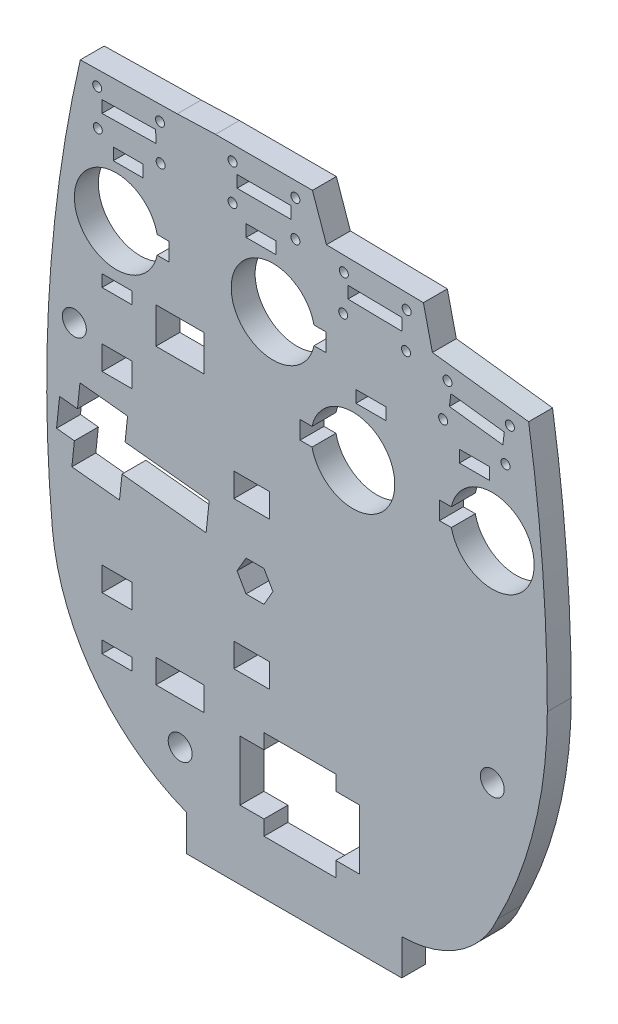
from build123d import *

# Parameters (mm, degrees)
SKETCH1_R           = 2
SKETCH1_R_2         = 0.75
SKETCH1_R_3         = 0.749999998
SKETCH1_R_4         = 0.750000004
SKETCH1_W           = 9
SKETCH1_H           = 2
SKETCH1_W_2         = 5
SKETCH1_W_3         = 8
SKETCH1_H_2         = 6.000000353
SKETCH1_H_3         = 4
SKETCH1_W_4         = 6.000000352
BOSS_EXTRUDE1_DEPTH = 4


with BuildPart() as part:
    # Sketch1 → Boss-Extrude1 (new body)
    with BuildSketch(Plane.XY):
        with BuildLine():
            Line((-12.978641063, -17.999999648), (-12.978641063, -24))
            Line((-12.978641063, -24), (23.021361236, -24))
            Line((23.021361236, -24), (23.021361236, -17.999999648))
            ThreePointArc((23.021361236, -17.999999648), (32.581207379, -15.140069872), (38.999866813, -7.5))
            ThreePointArc((38.999866813, -7.5), (45.227104339, 9.097953334), (47.34304259, 26.698900677))
            ThreePointArc((47.34304259, 26.698900677), (46.561010917, 46.955956043), (44.219571047, 67.092428548))
            Line((44.219571047, 67.092428548), (28.140428953, 69.067571452))
            Line((28.140428953, 69.067571452), (26.638766223, 75.523629346))
            Line((26.638766223, 75.523629346), (10.441233777, 75.806370654))
            Line((10.441233777, 75.806370654), (8.1, 82.51))
            Line((8.1, 82.51), (-8.1, 82.51))
            Line((-8.1, 82.51), (-14.491233669, 82.281364492))
            Line((-14.491233669, 82.281364492), (-30.688766331, 81.998635508))
            ThreePointArc((-30.688766331, 81.998635508), (-35.807455008, 47.09533049), (-35.352658257, 11.821617405))
            ThreePointArc((-35.352658257, 11.821617405), (-28.384965955, -6.25478255), (-12.978641063, -17.999999648))
        make_face()
        with Locations((38.147341743, 11.821617405)):
            Circle(SKETCH1_R, mode=Mode.SUBTRACT)
        with Locations((-14, -9.124358764)):
            Circle(SKETCH1_R, mode=Mode.SUBTRACT)
        with Locations((-5.25, 80.010000357)):
            Circle(SKETCH1_R_2, mode=Mode.SUBTRACT)
        with Locations((-31.681501662, 43.456405989)):
            Circle(SKETCH1_R, mode=Mode.SUBTRACT)
        with Locations((5.25, 80.010000357)):
            Circle(SKETCH1_R_2, mode=Mode.SUBTRACT)
        with Locations((5.25, 74.010000357)):
            Circle(SKETCH1_R_2, mode=Mode.SUBTRACT)
        with Locations((-5.25, 74.010000357)):
            Circle(SKETCH1_R_2, mode=Mode.SUBTRACT)
        with Locations((-27.865359192, 79.547537443)):
            Circle(SKETCH1_R_2, mode=Mode.SUBTRACT)
        with Locations((-17.366958393, 79.73078771)):
            Circle(SKETCH1_R_2, mode=Mode.SUBTRACT)
        with Locations((-27.760644754, 73.548451272)):
            Circle(SKETCH1_R_2, mode=Mode.SUBTRACT)
        with Locations((-17.262243954, 73.731701539)):
            Circle(SKETCH1_R_2, mode=Mode.SUBTRACT)
        with Locations((23.737064403, 67.072986046)):
            Circle(SKETCH1_R_3, mode=Mode.SUBTRACT)
        with Locations((13.238663748, 67.256244302)):
            Circle(SKETCH1_R_3, mode=Mode.SUBTRACT)
        with Locations((23.84178337, 73.072070044)):
            Circle(SKETCH1_R_3, mode=Mode.SUBTRACT)
        with Locations((13.343382789, 73.255332634)):
            Circle(SKETCH1_R_3, mode=Mode.SUBTRACT)
        with Locations((29.933677274, 60.289335547)):
            Circle(SKETCH1_R_4, mode=Mode.SUBTRACT)
        with Locations((41.086141157, 64.958390798)):
            Circle(SKETCH1_R_4, mode=Mode.SUBTRACT)
        with Locations((30.664512126, 66.238878444)):
            Circle(SKETCH1_R_4, mode=Mode.SUBTRACT)
        with Locations((40.355343455, 59.00915033)):
            Circle(SKETCH1_R_4, mode=Mode.SUBTRACT)
        with Locations((0, 77.51)):
            Rectangle(SKETCH1_W, SKETCH1_H, mode=Mode.SUBTRACT)
        Polygon((-9.666, 24.072257636), (-9.153, 28.953126601), (-23.204098338, 30.429956546), (-22.785984485, 34.408044128), (-30.742159647, 35.244271834), (-31.160273501, 31.266184253), (-34.143839187, 31.579769642), (-34.656839187, 26.698900677), (-31.673273501, 26.385315288), (-32.091387354, 22.407227706), (-24.135212191, 21.571), (-23.717098338, 25.549087581), align=None, mode=Mode.SUBTRACT)
        with BuildLine():
            Line((10.358817838, 63.151218734), (10.358817838, 60.151218734))
            Line((10.358817838, 60.151218734), (8.358817838, 60.151218734))
            ThreePointArc((8.358817838, 60.151218734), (-5.478579327, 61.651218734), (8.358817838, 63.151218734))
            Line((8.358817838, 63.151218734), (10.358817838, 63.151218734))
        make_face(mode=Mode.SUBTRACT)
        with Locations((35.147341743, 56.321617405)):
            Rectangle(SKETCH1_W_2, SKETCH1_H, mode=Mode.SUBTRACT)
        with BuildLine():
            Line((-17.84156291, 63.151218734), (-15.84156291, 63.151218734))
            Line((-15.84156291, 63.151218734), (-15.84156291, 60.151218734))
            Line((-15.84156291, 60.151218734), (-17.84156291, 60.151218734))
            ThreePointArc((-17.84156291, 60.151218734), (-31.678960076, 61.651218734), (-17.84156291, 63.151218734))
        make_face(mode=Mode.SUBTRACT)
        Polygon((-27.089294811, 78.060855205), (-18.090665555, 78.217926863), (-18.055760742, 76.218231472), (-27.054389998, 76.061159814), align=None, mode=Mode.SUBTRACT)
        with Locations((-14.054335075, 49.87557619)):
            Rectangle(SKETCH1_W_3, SKETCH1_H_2, mode=Mode.SUBTRACT)
        with Locations((17.86306514, 56.321617405)):
            Rectangle(SKETCH1_W_2, SKETCH1_H, mode=Mode.SUBTRACT)
        with Locations((-0.478579327, 71.151218734)):
            Rectangle(SKETCH1_W_2, SKETCH1_H, mode=Mode.SUBTRACT)
        Polygon((14.067088759, 71.742468995), (14.032182425, 69.742773631), (23.030811562, 69.585695127), (23.065717896, 71.585390491), align=None, mode=Mode.SUBTRACT)
        with BuildLine():
            Line((8.025667975, 48.321617405), (6.025667975, 48.321617405))
            Line((6.025667975, 48.321617405), (6.025667975, 45.321617405))
            Line((6.025667975, 45.321617405), (8.025667975, 45.321617405))
            ThreePointArc((8.025667975, 45.321617405), (21.86306514, 46.821617405), (8.025667975, 48.321617405))
        make_face(mode=Mode.SUBTRACT)
        Polygon((40.158871399, 63.561174357), (31.226014679, 64.658475971), (30.982169876, 62.6733967), (39.915026596, 61.576095086), align=None, mode=Mode.SUBTRACT)
        with BuildLine():
            Line((29.309944577, 45.321617405), (31.309944577, 45.321617405))
            ThreePointArc((31.309944577, 45.321617405), (45.147341743, 46.821617405), (31.309944577, 48.321617405))
            Line((31.309944577, 48.321617405), (29.309944577, 48.321617405))
            Line((29.309944577, 48.321617405), (29.309944577, 45.321617405))
        make_face(mode=Mode.SUBTRACT)
        with Locations((-22.678960076, 71.151218734)):
            Rectangle(SKETCH1_W_2, SKETCH1_H, mode=Mode.SUBTRACT)
        Polygon((-4, -2.5), (0, -2.5), (0, 0), (12, 0), (12, -2.5), (16, -2.5), (16, -12.5), (12, -12.5), (12, -15), (0, -15), (0, -12.5), (-4, -12.5), align=None, mode=Mode.SUBTRACT)
        with Locations((-24.554335075, 51.875576367)):
            Rectangle(SKETCH1_W_2, SKETCH1_H, mode=Mode.SUBTRACT)
        with Locations((-14.054335075, -0.124358764)):
            Rectangle(SKETCH1_W_3, SKETCH1_H_3, mode=Mode.SUBTRACT)
        with Locations((-24.554335075, -1.124358764)):
            Rectangle(SKETCH1_W_2, SKETCH1_H, mode=Mode.SUBTRACT)
        Polygon((0, 23.754659123), (-3, 23.754659123), (-4.5, 21.156582912), (-3, 18.5585067), (0, 18.5585067), (1.5, 21.156582912), align=None, mode=Mode.SUBTRACT)
        with Locations((-2.036620161, 8.717005814)):
            Rectangle(SKETCH1_W_4, SKETCH1_H_3, mode=Mode.SUBTRACT)
        with Locations((-2.036620161, 33.335566927)):
            Rectangle(SKETCH1_W_4, SKETCH1_H_3, mode=Mode.SUBTRACT)
        with Locations((-24.554335075, 8.717005814)):
            Rectangle(SKETCH1_W_2, SKETCH1_H_3, mode=Mode.SUBTRACT)
        with Locations((-24.554335075, 40.727245232)):
            Rectangle(SKETCH1_W_2, SKETCH1_H_3, mode=Mode.SUBTRACT)
    extrude(amount=BOSS_EXTRUDE1_DEPTH)


solid = part.part
